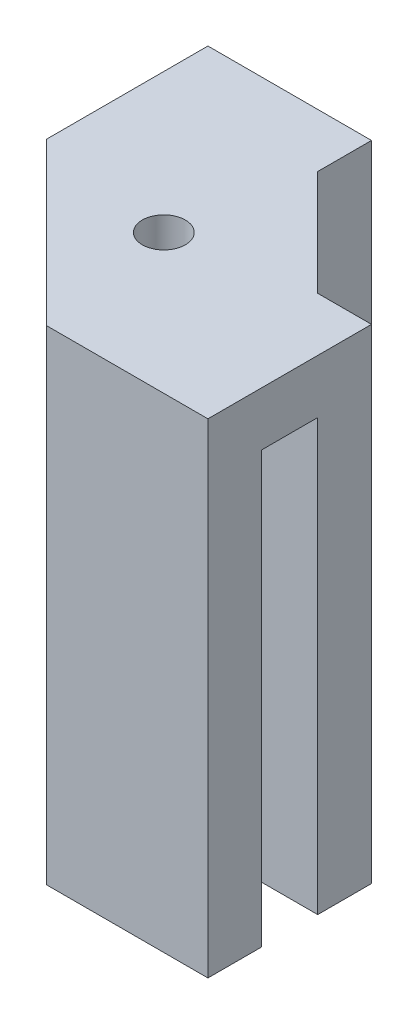
from build123d import *

# Parameters (mm, degrees)
BOSS_EXTRUDE1_DEPTH         = 50.8
TAP_DRILL_FOR_1_4_20_TAP1_D = 5.08
SKETCH4_R                   = 2.5399999999999947
BOSS_EXTRUDE2_DEPTH         = 6.35


with BuildPart() as part:
    # Sketch1 → Boss-Extrude1 (new body)
    with BuildSketch(Plane(origin=(0, 0, 0), x_dir=(1, 0, 0), z_dir=(0, 1, 0))):
        Polygon((22.098000000000056, 9.651999999999928), (9.652000000000001, 22.098000000000024), (9.652000000000001, 28.447999999999904), (3.3019999999999996, 28.447999999999904), (3.302000000000003, 15.747999999999971), (-3.3020000000000005, 15.747999999999967), (-3.3020000000000014, 28.447999999999904), (-9.652000000000001, 28.447999999999904), (-9.652, 9.397999999999913), (9.397999999999879, -9.652000000000031), (28.447999999999862, -9.652000000000092), (28.44799999999989, -3.3020000000001004), (15.747999999999957, -3.3020000000000556), (15.747999999999982, 3.3019999999999445), (28.447999999999915, 3.3019999999998992), (28.447999999999933, 9.65199999999991), align=None)
    extrude(amount=BOSS_EXTRUDE1_DEPTH)

    # Tap Drill for 1/4-20 Tap1 (through all)
    with Locations(Plane(origin=(0, 50.8, 0), x_dir=(1, 0, 0), z_dir=(0, 1, 0))):
        with Locations((6.795346667, 6.795346667)):
            Hole(TAP_DRILL_FOR_1_4_20_TAP1_D / 2)

    # Sketch4 → Boss-Extrude2 (add)
    with BuildSketch(Plane(origin=(0, 50.8, 0), x_dir=(1, 0, 0), z_dir=(0, 1, 0))):
        Polygon((-3.3020000000000014, 28.447999999999904), (3.3019999999999996, 28.447999999999904), (9.652000000000001, 28.447999999999904), (9.652000000000001, 22.098000000000024), (22.098000000000056, 9.651999999999928), (28.447999999999933, 9.65199999999991), (28.447999999999915, 3.3019999999998992), (28.44799999999989, -3.3020000000001004), (28.447999999999862, -9.652000000000092), (9.397999999999879, -9.652000000000031), (-9.652, 9.397999999999913), (-9.652000000000001, 28.447999999999904), align=None)
        with Locations((6.7953466666666715, 6.7953466666666476)):
            Circle(SKETCH4_R, mode=Mode.SUBTRACT)
    extrude(amount=BOSS_EXTRUDE2_DEPTH)


solid = part.part
